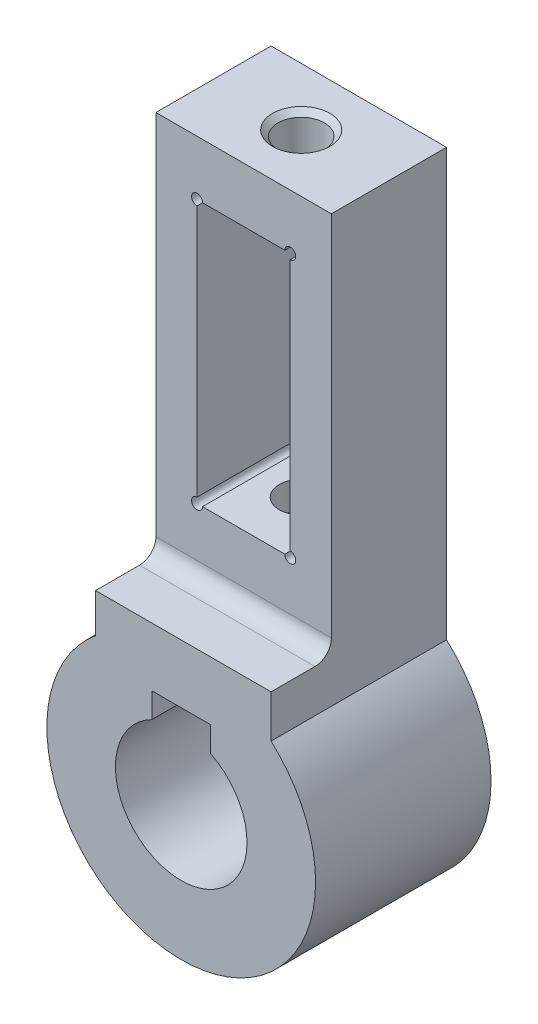
from build123d import *

# Parameters (mm, degrees)
SKETCH1_W                 = 32
SKETCH1_H                 = 70
BOSS_EXTRUDE1_DEPTH       = 21
BOSS_EXTRUDE2_DEPTH       = 32
FILLET1_R                 = 3
SKETCH4_R                 = 4.231264656
CUT_EXTRUDE1_DEPTH        = 32
CHAMFER1_SIZE             = 1
F_8_0MM_DOWEL_HOLE1_D     = 8
F_8_0MM_DOWEL_HOLE1_DEPTH = 5
F_8_0MM_DOWEL_HOLE1_TIP   = 2.403442476


with BuildPart() as part:
    # Sketch1 → Boss-Extrude1 (new body)
    with BuildSketch(Plane.XY):
        with Locations((0, -1)):
            Rectangle(SKETCH1_W, SKETCH1_H)
        with BuildLine():
            ThreePointArc((-8.5, 23), (-9.207106781, 24.707106781), (-7.5, 24))
            Line((-7.5, 24), (7.5, 24))
            ThreePointArc((7.5, 24), (8.5, 25), (9.5, 24))
            ThreePointArc((9.5, 24), (9.207106781, 23.292893219), (8.5, 23))
            Line((8.5, 23), (8.5, -23))
            ThreePointArc((8.5, -23), (9.207106781, -23.292893219), (9.5, -24))
            ThreePointArc((9.5, -24), (8.5, -25), (7.5, -24))
            Line((7.5, -24), (-7.5, -24))
            ThreePointArc((-7.5, -24), (-9.207106781, -24.707106781), (-8.5, -23))
            Line((-8.5, -23), (-8.5, 23))
        make_face(mode=Mode.SUBTRACT)
    extrude(amount=BOSS_EXTRUDE1_DEPTH)

    # Sketch3 → Boss-Extrude2 (add)
    with BuildSketch(Plane.XY):
        with BuildLine():
            Line((16, -36), (-16, -36))
            Line((-16, -36), (-16, -43.121704639))
            ThreePointArc((-16, -43.121704639), (-0.891104212, -86.494751046), (16, -43.784208026))
            Line((16, -43.784208026), (16, -36))
        make_face()
        with BuildLine():
            ThreePointArc((4.989425576, -51.270299516), (-0.383983726, -74), (-5.757393028, -51.270299516))
            Line((-5.757393028, -51.270299516), (-5.757393028, -46.7))
            Line((-5.757393028, -46.7), (4.989425576, -46.7))
            Line((4.989425576, -46.7), (4.989425576, -51.270299516))
        make_face(mode=Mode.SUBTRACT)
    extrude(amount=BOSS_EXTRUDE2_DEPTH)

    # Fillet1
    fillet1_edges = [part.edges().sort_by_distance(p)[0] for p in [
        (0, -36, 21),
    ]]
    fillet(fillet1_edges, radius=FILLET1_R)

    # Sketch4 → Cut-Extrude1 (cut)
    with BuildSketch(Plane(origin=(0, 34, 0), x_dir=(1, 0, 0), z_dir=(0, 1, 0))):
        with Locations((0, -10.5)):
            Circle(SKETCH4_R)
    extrude(amount=-CUT_EXTRUDE1_DEPTH, mode=Mode.SUBTRACT)

    # Chamfer1
    chamfer1_edges = [part.edges().sort_by_distance(p)[0] for p in [
        (-4.231264656, 34, 10.5),
    ]]
    chamfer(chamfer1_edges, length=CHAMFER1_SIZE)

    # Ø8.0mm Dowel Hole1
    with Locations(Plane(origin=(0, -24, 10.5), x_dir=(0, 0, 1), z_dir=(0, 1, 0))):
        with Locations((0, 0)):
            Hole(F_8_0MM_DOWEL_HOLE1_D / 2, depth=F_8_0MM_DOWEL_HOLE1_DEPTH)
            with Locations((0, 0, -(F_8_0MM_DOWEL_HOLE1_DEPTH + F_8_0MM_DOWEL_HOLE1_TIP / 2))):  # 118° drill point
                Cone(0, F_8_0MM_DOWEL_HOLE1_D / 2, F_8_0MM_DOWEL_HOLE1_TIP, mode=Mode.SUBTRACT)


solid = part.part
